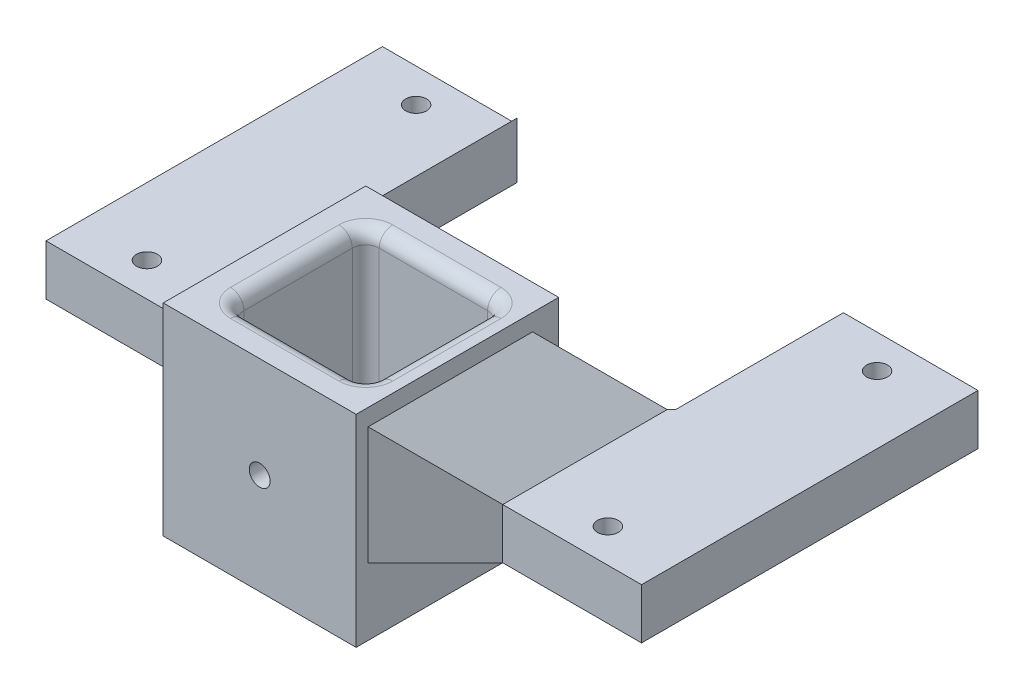
from build123d import *

# Parameters (mm, degrees)
BOSS_EXTRUDE3_START = 180
SKETCH2_R           = 1.55
SKETCH2_W           = 20.1
SKETCH2_H           = 20.1
BOSS_EXTRUDE3_DEPTH = 7.5
BOSS_EXTRUDE4_START = 170
SKETCH2_3_W         = 28.669908379
SKETCH2_3_H         = 30.1
SKETCH2_3_W_2       = 20.1
SKETCH2_3_H_2       = 20.1
BOSS_EXTRUDE4_DEPTH = 30
CHAMFER1_SIZE       = 10
CHAMFER2_SIZE       = 10
SKETCH3_R           = 1.55
CUT_EXTRUDE1_DEPTH  = 43
FILLET1_R           = 2


with BuildPart() as part:
    # Sketch2 → Boss-Extrude3 (new body)
    with BuildSketch(Plane(origin=(0, 0, 0), x_dir=(1, 0, 0), z_dir=(0, 1, 0)).offset(BOSS_EXTRUDE3_START)):
        Polygon((-34.3, 56.78), (-54.3, 56.78), (-54.3, 6.78), (-25.1, 6.78), (-25.1, -5), (3.569908379, -5), (3.569908379, 6.78), (34.2, 6.78), (34.2, 56.78), (14.2, 56.78), (14.2, 31.85), (3.569908379, 21.219908379), (3.569908379, 25.1), (-25.1, 25.1), (-25.1, 22.65), (-34.3, 31.85), align=None)
        with Locations((-44.3, 11.78)):
            Circle(SKETCH2_R, mode=Mode.SUBTRACT)
        with Locations((-44.3, 51.78)):
            Circle(SKETCH2_R, mode=Mode.SUBTRACT)
        with Locations((-10.05, 10.05)):
            Rectangle(SKETCH2_W, SKETCH2_H, mode=Mode.SUBTRACT)
        with Locations((24.2, 51.78)):
            Circle(SKETCH2_R, mode=Mode.SUBTRACT)
        with Locations((24.2, 11.78)):
            Circle(SKETCH2_R, mode=Mode.SUBTRACT)
    extrude(amount=BOSS_EXTRUDE3_DEPTH)

    # Sketch2<3> → Boss-Extrude4 (add)
    with BuildSketch(Plane(origin=(0, 0, 0), x_dir=(1, 0, 0), z_dir=(0, 1, 0)).offset(BOSS_EXTRUDE4_START)):
        with Locations((-10.765045811, 10.05)):
            Rectangle(SKETCH2_3_W, SKETCH2_3_H)
        with Locations((-10.05, 10.05)):
            Rectangle(SKETCH2_3_W_2, SKETCH2_3_H_2, mode=Mode.SUBTRACT)
    extrude(amount=BOSS_EXTRUDE4_DEPTH)

    # Chamfer1
    chamfer1_edges = [part.edges().sort_by_distance(p)[0] for p in [
        (-25.1, 187.5, -14.715),
        (3.569908379, 187.5, -13.999954189),
    ]]
    chamfer(chamfer1_edges, length=CHAMFER1_SIZE)

    # Chamfer2
    chamfer2_edges = [part.edges().sort_by_distance(p)[0] for p in [
        (-25.1, 188.75, -6.78),
        (3.569908379, 188.75, -6.78),
    ]]
    chamfer(chamfer2_edges, length=CHAMFER2_SIZE)

    # Sketch3 → Cut-Extrude1 (cut)
    with BuildSketch(Plane(origin=(0, 0, -25.1), x_dir=(-1, 0, 0), z_dir=(0, 0, -1))):
        with Locations((10.765045811, 185)):
            Circle(SKETCH3_R)
    extrude(amount=-CUT_EXTRUDE1_DEPTH, mode=Mode.SUBTRACT)

    # Fillet1
    fillet1_edges = [part.edges().sort_by_distance(p)[0] for p in [
        (-10.05, 200, -20.1),
        (-10.05, 200, 0),
        (-10.05, 170, 0),
        (-10.05, 170, -20.1),
        (-20.1, 200, -10.05),
        (-20.1, 185, -20.1),
        (-20.1, 170, -10.05),
        (-20.1, 185, 0),
        (0, 200, -10.05),
        (0, 185, 0),
        (0, 170, -10.05),
        (0, 185, -20.1),
    ]]
    fillet(fillet1_edges, radius=FILLET1_R)


solid = part.part
